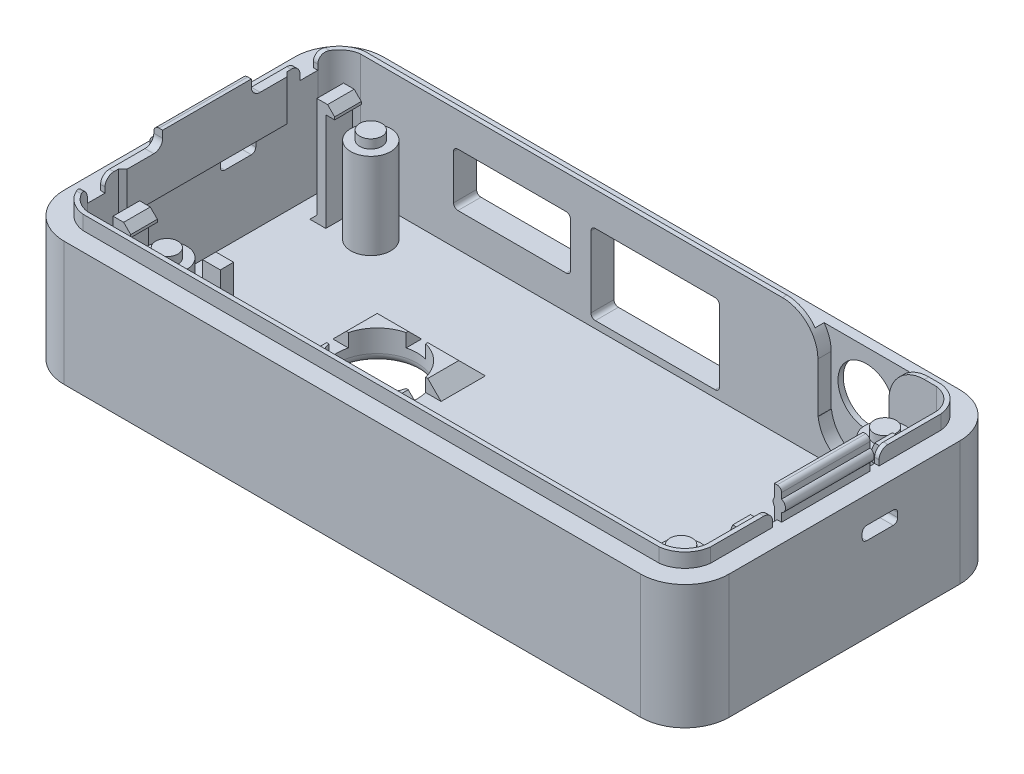
from build123d import *
from OCP.BRepFilletAPI import BRepFilletAPI_MakeChamfer

# Parameters (mm, degrees)
EXTRUDE_2_DEPTH       = 14
EXTRUDE_4_DEPTH       = 1.6
CUT_EXTRUDE_START     = -12
CUT_EXTRUDE_2_DEPTH   = 12
EXTRUDE_12_DEPTH      = 1.6
EXTRUDE_12_DEPTH_BACK = 2
SKETCH_5_W            = 0.3
SKETCH_5_H            = 10
SKETCH_15_R           = 2.25
EXTRUDE_13_DEPTH      = 9.7
SKETCH_16_R           = 1.25
EXTRUDE_14_DEPTH      = 1
SKETCH_17_W           = 0.5
SKETCH_17_H           = 1
CUT_EXTRUDE_3_DEPTH   = 1.6
SKETCH_19_W           = 0.8
SKETCH_19_H           = 10
EXTRUDE_15_DEPTH      = 1.8
SKETCH_20_R           = 0.7
EXTRUDE_16_DEPTH      = 10
FILLET_4_R            = 0.5
SKETCH_39_R           = 4
CUT_EXTRUDE_4_DEPTH   = 0.5
SKETCH_41_W           = 14.5
SKETCH_41_H           = 9
SKETCH_41_W_2         = 13.2
SKETCH_41_H_2         = 6
CUT_EXTRUDE_5_DEPTH   = 12
SKETCH_42_R           = 3.2
CUT_EXTRUDE_6_DEPTH   = 1.6
SKETCH_46_W           = 20
SKETCH_46_H           = 4.6
EXTRUDE_19_DEPTH      = 0.5
CHAMFER_3_SIZE        = 1
SKETCH_48_W           = 1
SKETCH_48_H           = 10
EXTRUDE_21_DEPTH      = 1.8
SKETCH_49_R           = 0.7
EXTRUDE_22_DEPTH      = 10
SKETCH_50_W           = 0.5
SKETCH_50_H           = 2
CUT_EXTRUDE_10_DEPTH  = 1.6
FILLET_9_R            = 1
FILLET_10_R           = 0.6
SKETCH_52_W           = 9.2
SKETCH_52_H           = 9.2
EXTRUDE_23_DEPTH      = 1.5
CHAMFER_5_SIZE        = 1.5
CUT_EXTRUDE_12_REACH  = 48.379
SKETCH_53_R           = 4.5
FILLET_14_R           = 1
SKETCH_55_W           = 12.2
SKETCH_55_H           = 2.2
CUT_EXTRUDE_13_DEPTH  = 1.5
SKETCH_56_W           = 2.2
SKETCH_56_H           = 12.2
CUT_EXTRUDE_14_DEPTH  = 1.5
FILLET_17_R           = 1
SKETCH_63_W           = 2
SKETCH_63_H           = 1.5
EXTRUDE_24_DEPTH      = 6
FILLET_18_R           = 0.5
CUT_EXTRUDE_15_DEPTH  = 0.5
CUT_EXTRUDE_16_REACH  = 81.068
SKETCH_67_W           = 4
SKETCH_67_H           = 1.5
FILLET_20_R           = 0.5
CUT_EXTRUDE_17_REACH  = 78.606
SKETCH_71_W           = 2
SKETCH_71_H           = 2
EXTRUDE_28_DEPTH      = 1.8
CHAMFER_6_SIZE        = 0.8
CHAMFER_6_SIZE2       = 1.980069483
SKETCH_73_W           = 1
SKETCH_73_H           = 3
EXTRUDE_30_DEPTH      = 12.2
SKETCH_74_W           = 3
SKETCH_74_H           = 1.1
EXTRUDE_31_DEPTH      = 1
CHAMFER_7_SIZE        = 0.8
SKETCH_75_R           = 4
CUT_EXTRUDE_19_DEPTH  = 1.5
SKETCH_76_W           = 8
SKETCH_76_H           = 9.611690882
CUT_EXTRUDE_20_DEPTH  = 1.5
FILLET_21_R           = 4
CUT_EXTRUDE_21_REACH  = 48.379
SKETCH_77_W           = 53.042222275
SKETCH_77_H           = 6.123277872
FILLET_22_R           = 1


# Read off the part's stored shape, not the designer's step: 切除-拉伸15
# Some blends are built 0.0001 mm under size
with BuildPart() as part:
    # case 2 → 凸台-拉伸2 (new body)
    with BuildSketch(Plane(origin=(0, 0, 0), x_dir=(1, 0, 0), z_dir=(0, 1, 0))):
        with BuildLine():
            Line((-34.042196447, 18), (30.957803553, 18))
            ThreePointArc((30.957803553, 18), (34.493337459, 16.535533906), (35.957803553, 13))
            Line((35.957803553, 13), (35.957803553, -13))
            ThreePointArc((35.957803553, -13), (34.493337459, -16.535533906), (30.957803553, -18))
            Line((30.957803553, -18), (-34.042196447, -18))
            ThreePointArc((-34.042196447, -18), (-37.577730353, -16.535533906), (-39.042196447, -13))
            Line((-39.042196447, -13), (-39.042196447, 13))
            ThreePointArc((-39.042196447, 13), (-37.577730353, 16.535533906), (-34.042196447, 18))
        make_face()
    extrude(amount=EXTRUDE_2_DEPTH)

    # 草图3 → 凸台-拉伸4 (add)
    with BuildSketch(Plane(origin=(0, 14, 0), x_dir=(1, 0, 0), z_dir=(0, 1, 0))):
        with BuildLine():
            Line((-36.942196447, 13), (-36.942196447, -13))
            ThreePointArc((-36.942196447, -13), (-35.997398295, -14.955201848), (-34.042196447, -15.9))
            Line((-34.042196447, -15.9), (30.957803553, -15.9))
            ThreePointArc((30.957803553, -15.9), (32.913005401, -14.955201848), (33.857803553, -13))
            Line((33.857803553, -13), (33.857803553, 13))
            ThreePointArc((33.857803553, 13), (32.913005401, 14.955201848), (30.957803553, 15.9))
            Line((30.957803553, 15.9), (-34.042196447, 15.9))
            ThreePointArc((-34.042196447, 15.9), (-35.997398295, 14.955201848), (-36.942196447, 13))
        make_face()
        with BuildLine():
            Line((-34.042196447, -15.4), (30.957803553, -15.4))
            ThreePointArc((30.957803553, -15.4), (32.562900965, -14.605097413), (33.357803553, -13))
            Line((33.357803553, -13), (33.357803553, 13))
            ThreePointArc((33.357803553, 13), (32.562900965, 14.605097413), (30.957803553, 15.4))
            Line((30.957803553, 15.4), (-34.042196447, 15.4))
            ThreePointArc((-34.042196447, 15.4), (-35.64729386, 14.605097413), (-36.442196447, 13))
            Line((-36.442196447, 13), (-36.442196447, -13))
            ThreePointArc((-36.442196447, -13), (-35.64729386, -14.605097413), (-34.042196447, -15.4))
        make_face(mode=Mode.SUBTRACT)
    extrude(amount=EXTRUDE_4_DEPTH)

    # 草图14 → 切除-拉伸2 (cut)
    with BuildSketch(Plane(origin=(0, 14, 0), x_dir=(1, 0, 0), z_dir=(0, 1, 0)).offset(CUT_EXTRUDE_START)):
        with BuildLine():
            Line((-34.042196447, -15.4), (30.957803553, -15.4))
            ThreePointArc((30.957803553, -15.4), (32.562900965, -14.605097413), (33.357803553, -13))
            Line((33.357803553, -13), (33.357803553, 13))
            ThreePointArc((33.357803553, 13), (32.562900965, 14.605097413), (30.957803553, 15.4))
            Line((30.957803553, 15.4), (-34.042196447, 15.4))
            ThreePointArc((-34.042196447, 15.4), (-35.64729386, 14.605097413), (-36.442196447, 13))
            Line((-36.442196447, 13), (-36.442196447, -13))
            ThreePointArc((-36.442196447, -13), (-35.64729386, -14.605097413), (-34.042196447, -15.4))
        make_face()
    extrude(amount=CUT_EXTRUDE_2_DEPTH, mode=Mode.SUBTRACT)

    # 草图5 → 凸台-拉伸12 (add, two sides: drawn at the far end of the back side and taken through both)
    with BuildSketch(Plane(origin=(0, 14, 0), x_dir=(1, 0, 0), z_dir=(0, 1, 0)).offset(-EXTRUDE_12_DEPTH_BACK)):
        with Locations((33.207803553, 0)):
            Rectangle(SKETCH_5_W, SKETCH_5_H)
    extrude(amount=EXTRUDE_12_DEPTH + EXTRUDE_12_DEPTH_BACK)

    # 草图15 → 凸台-拉伸13 (add)
    with BuildSketch(Plane(origin=(0, 2, 0), x_dir=(1, 0, 0), z_dir=(0, 1, 0))):
        with Locations(Location((29.060337171, -11.529492838, 0), (0, 0, 270))):
            Circle(SKETCH_15_R)
        with Locations(Location((-28.939662829, -11.529492838, 0), (0, 0, 270))):
            Circle(SKETCH_15_R)
        with Locations(Location((29.060337171, 11.470507162, 0), (0, 0, 270))):
            Circle(SKETCH_15_R)
        with Locations(Location((-28.939662829, 11.470507162, 0), (0, 0, 270))):
            Circle(SKETCH_15_R)
    extrude(amount=EXTRUDE_13_DEPTH)

    # 草图16 → 凸台-拉伸14 (add)
    with BuildSketch(Plane(origin=(0, 11.7, 0), x_dir=(1, 0, 0), z_dir=(0, 1, 0))):
        with Locations(Location((29.060337171, -11.529492838, 0), (0, 0, 270))):
            Circle(SKETCH_16_R)
        with Locations(Location((29.060337171, 11.470507162, 0), (0, 0, 270))):
            Circle(SKETCH_16_R)
        with Locations(Location((-28.939662829, -11.529492838, 0), (0, 0, 270))):
            Circle(SKETCH_16_R)
        with Locations(Location((-28.939662829, 11.470507162, 0), (0, 0, 270))):
            Circle(SKETCH_16_R)
    extrude(amount=EXTRUDE_14_DEPTH)

    # 草图17 → 切除-拉伸3 (cut)
    with BuildSketch(Plane(origin=(0, 15.6, 0), x_dir=(1, 0, 0), z_dir=(0, 1, 0))):
        with Locations((33.607803553, -5.5)):
            Rectangle(SKETCH_17_W, SKETCH_17_H)
        with Locations((33.607803553, 5.5)):
            Rectangle(SKETCH_17_W, SKETCH_17_H)
    extrude(amount=-CUT_EXTRUDE_3_DEPTH, mode=Mode.SUBTRACT)

    # 草图19 → 凸台-拉伸15 (add)
    with BuildSketch(Plane(origin=(0, 15.6, 0), x_dir=(1, 0, 0), z_dir=(0, 1, 0))):
        with Locations((33.457803553, 0)):
            Rectangle(SKETCH_19_W, SKETCH_19_H)
    extrude(amount=EXTRUDE_15_DEPTH)

    # 草图20 → 凸台-拉伸16 (add)
    with BuildSketch(Plane(origin=(0, 0, -5), x_dir=(-1, 0, 0), z_dir=(0, 0, -1))):
        with Locations((-33.607803553, 15.6)):
            Circle(SKETCH_20_R)
    extrude(amount=-EXTRUDE_16_DEPTH)

    # 圆角4
    fillet_4_edges = [part.edges().sort_by_distance(p)[0] for p in [
        (33.857803553, 17.4, 0),
    ]]
    fillet(fillet_4_edges, radius=FILLET_4_R)

    # 草图39 → 切除-拉伸4 (cut)
    with BuildSketch(Plane(origin=(0, 0, -18), x_dir=(-1, 0, 0), z_dir=(0, 0, -1))):
        with Locations((-21.521910192, 9.17282056)):
            Circle(SKETCH_39_R)
    extrude(amount=-CUT_EXTRUDE_4_DEPTH, mode=Mode.SUBTRACT)

    # 草图41 → 切除-拉伸5 (cut)
    with BuildSketch(Plane(origin=(0, 0, -18), x_dir=(-1, 0, 0), z_dir=(0, 0, -1))):
        with Locations((0.792196447, 7.3)):
            Rectangle(SKETCH_41_W, SKETCH_41_H)
        with Locations((16.942196447, 8.8)):
            Rectangle(SKETCH_41_W_2, SKETCH_41_H_2)
    extrude(amount=-CUT_EXTRUDE_5_DEPTH, mode=Mode.SUBTRACT)

    # 草图42 → 切除-拉伸6 (cut)
    with BuildSketch(Plane(origin=(0, 0, -17.5), x_dir=(-1, 0, 0), z_dir=(0, 0, -1))):
        with Locations((-21.521910192, 9.17282056)):
            Circle(SKETCH_42_R)
    extrude(amount=-CUT_EXTRUDE_6_DEPTH, mode=Mode.SUBTRACT)

    # 草图46 → 凸台-拉伸19 (add)
    with BuildSketch(Plane(origin=(-36.442196447, 0, 0), x_dir=(0, 0, -1), z_dir=(1, 0, 0))):
        with Locations((0, 13.3)):
            Rectangle(SKETCH_46_W, SKETCH_46_H)
    extrude(amount=EXTRUDE_19_DEPTH)

    # 倒角3
    # the kernel refuses this chamfer: 1 mm, written as the material it takes off along each edge
    with BuildSketch(Plane(origin=(-35.942196447, 18.171682988, -10), x_dir=(-0.9996219169112968, 0, -0.02749587661058555), z_dir=(0, -1, 0))) as chamfer_3_piece_1_section:
        Polygon((CHAMFER_3_SIZE * 0.999621916911, -CHAMFER_3_SIZE * 0.0274958766106), (-CHAMFER_3_SIZE * 0.0274958766106, -CHAMFER_3_SIZE * 0.999621916911), (0, 0), align=None)
    chamfer_3_piece_1 = extrude(amount=9.743365976, mode=Mode.PRIVATE)
    chamfer_3_piece_1 = split(chamfer_3_piece_1, bisect_by=Plane(origin=(-36.442196447, 13.3, -9.606598916), z_dir=(1, 0, 0)), keep=Keep.TOP, mode=Mode.PRIVATE)
    add(chamfer_3_piece_1, mode=Mode.SUBTRACT)
    with BuildSketch(Plane(origin=(-35.942196447, 8.428317012, 10), x_dir=(-0.9996219169112968, 0, 0.02749587661058555), z_dir=(0, 1, 0))) as chamfer_3_piece_2_section:
        Polygon((CHAMFER_3_SIZE * 0.999621916911, -CHAMFER_3_SIZE * 0.0274958766106), (-CHAMFER_3_SIZE * 0.0274958766106, -CHAMFER_3_SIZE * 0.999621916911), (0, 0), align=None)
    chamfer_3_piece_2 = extrude(amount=9.743365976, mode=Mode.PRIVATE)
    chamfer_3_piece_2 = split(chamfer_3_piece_2, bisect_by=Plane(origin=(-36.442196447, 13.3, 9.606598916), z_dir=(1, 0, 0)), keep=Keep.TOP, mode=Mode.PRIVATE)
    add(chamfer_3_piece_2, mode=Mode.SUBTRACT)

    # 草图48 → 凸台-拉伸21 (add)
    with BuildSketch(Plane(origin=(0, 15.6, 0), x_dir=(1, 0, 0), z_dir=(0, 1, 0))):
        with Locations((-36.442196447, 0)):
            Rectangle(SKETCH_48_W, SKETCH_48_H)
    extrude(amount=EXTRUDE_21_DEPTH)

    # 草图49 → 凸台-拉伸22 (add)
    with BuildSketch(Plane.XY.offset(5)):
        with Locations((-36.692196447, 15.6)):
            Circle(SKETCH_49_R)
    extrude(amount=-EXTRUDE_22_DEPTH)

    # 草图50 → 切除-拉伸10 (cut)
    with BuildSketch(Plane(origin=(0, 15.6, 0), x_dir=(1, 0, 0), z_dir=(0, 1, 0))):
        with Locations((-36.692196447, 12)):
            Rectangle(SKETCH_50_W, SKETCH_50_H)
        with Locations((-36.692196447, -12)):
            Rectangle(SKETCH_50_W, SKETCH_50_H)
    extrude(amount=-CUT_EXTRUDE_10_DEPTH, mode=Mode.SUBTRACT)

    # 圆角9
    fillet_9_edges = [part.edges().sort_by_distance(p)[0] for p in [
        (33.607803553, 15.6, 6),
        (33.607803553, 15.6, -6),
        (-36.692196447, 15.6, -13),
        (-36.692196447, 15.6, -11),
        (-36.692196447, 15.6, 11),
        (-36.692196447, 15.6, 13),
    ]]
    fillet(fillet_9_edges, radius=FILLET_9_R)

    # 圆角10
    fillet_10_edges = [part.edges().sort_by_distance(p)[0] for p in [
        (-36.942196447, 17.4, 0),
    ]]
    fillet(fillet_10_edges, radius=FILLET_10_R)

    # 草图52 → 凸台-拉伸23 (add)
    with BuildSketch(Plane(origin=(0, 2, 0), x_dir=(1, 0, 0), z_dir=(0, 1, 0))):
        with Locations((-15.242196447, -1.5)):
            Rectangle(SKETCH_52_W, SKETCH_52_H)
    extrude(amount=EXTRUDE_23_DEPTH)

    # 倒角5
    chamfer_5_edges = [part.edges().sort_by_distance(p)[0] for p in [
        (-15.242196447, 2, -3.1),
        (-10.642196447, 2, 1.5),
        (-15.242196447, 2, 6.1),
        (-19.842196447, 2, 1.5),
    ]]
    chamfer(chamfer_5_edges, length=CHAMFER_5_SIZE - 0.0001)  # a hair under: the kernel refuses the full size

    # 草图53 → 切除-拉伸12 (cut, up to next)
    with BuildSketch(Plane.XZ, mode=Mode.PRIVATE) as cut_extrude_12_sk1:
        with Locations(Location((-15.242196447, 1.5, 0), (0, 0, 270))):
            Circle(SKETCH_53_R)
    cut_extrude_12_tool1 = extrude(cut_extrude_12_sk1.sketch, amount=-CUT_EXTRUDE_12_REACH, mode=Mode.PRIVATE) & part.part
    add(cut_extrude_12_tool1.solids().sort_by_distance((-15.242196, 0, 1.5))[0], mode=Mode.SUBTRACT)

    # 圆角14
    fillet_14_edges = [part.edges().sort_by_distance(p)[0] for p in [
        (-15.242196447, 0, 6),
    ]]
    fillet(fillet_14_edges, radius=FILLET_14_R)

    # 草图55 → 切除-拉伸13 (cut)
    with BuildSketch(Plane(origin=(0, 3.5, 0), x_dir=(1, 0, 0), z_dir=(0, 1, 0))):
        with Locations((-15.242196447, -1.5)):
            Rectangle(SKETCH_55_W, SKETCH_55_H)
    extrude(amount=-CUT_EXTRUDE_13_DEPTH, mode=Mode.SUBTRACT)

    # 草图56 → 切除-拉伸14 (cut)
    with BuildSketch(Plane(origin=(0, 3.5, 0), x_dir=(1, 0, 0), z_dir=(0, 1, 0))):
        with Locations((-15.242196447, -1.5)):
            Rectangle(SKETCH_56_W, SKETCH_56_H)
    extrude(amount=-CUT_EXTRUDE_14_DEPTH, mode=Mode.SUBTRACT)

    # 圆角17
    # the kernel refuses this fillet: 1 mm, written as the material it adds along each edge
    with BuildSketch(Plane(origin=(-36.942196447, 15.6, -5), x_dir=(0, 0, -1), z_dir=(1, 0, 0)), Plane(origin=(-35.942196447, 15.6, 5), x_dir=(0, 0, 1), z_dir=(-1, 0, 0))) as fillet_17_piece_1:
        with BuildLine():
            CenterArc((FILLET_17_R, FILLET_17_R), FILLET_17_R, 180, 90)
            Line((0, FILLET_17_R), (0, 0))
            Line((0, 0), (FILLET_17_R, 0))
        make_face()
    extrude(amount=1)

    # 草图63 → 凸台-拉伸24 (add)
    with BuildSketch(Plane(origin=(0, 2, 0), x_dir=(1, 0, 0), z_dir=(0, 1, 0))):
        with Locations((-29.442196447, -5.25)):
            Rectangle(SKETCH_63_W, SKETCH_63_H)
    extrude(amount=EXTRUDE_24_DEPTH)

    # 圆角18
    fillet_18_edges = [part.edges().sort_by_distance(p)[0] for p in [
        (6.457803553, 2.8, -16.7),
        (6.457803553, 11.8, -16.7),
        (-8.042196447, 11.8, -16.7),
        (-8.042196447, 2.8, -16.7),
        (-10.342196447, 5.8, -16.7),
        (-10.342196447, 11.8, -16.7),
        (-23.542196447, 11.8, -16.7),
        (-23.542196447, 5.8, -16.7),
    ]]
    fillet(fillet_18_edges, radius=FILLET_18_R)

    # 切除-拉伸15 outline → 切除-拉伸15 (cut)
    with BuildSketch(Plane(origin=(0, 0, 0), x_dir=(1, 0, 0), z_dir=(0, 1, 0))):
        with BuildLine():
            add(Edge.make_bspline(
                [(26.920722884, 6.833155185), (27.053776021, 6.757558732), (27.20148009, 6.715969894), (27.49780189, 6.712576515), (27.646384842, 6.750772373), (27.78116905, 6.823301641)],
                knots=[4, 4, 4, 4, 5, 5, 6, 6, 6, 6], degree=3))
            Line((27.78116905, 6.823301641), (28.194169459, 7.057938986))
            Line((28.194169459, 7.057938986), (30.336531894, 8.261545504))
            Line((30.336531894, 8.261545504), (30.749499644, 8.493330924))
            add(Edge.make_bspline(
                [(31.188238435, 9.232025797), (31.184747278, 8.927165616), (31.019098798, 8.644111097), (30.749499644, 8.493330924)],
                knots=[21, 21, 21, 21, 22, 22, 22, 22], degree=3))
            Line((31.188238435, 9.232025797), (31.227260896, 12.639604768))
            add(Edge.make_bspline(
                [(30.805553521, 13.388153184), (31.071629058, 13.231238642), (31.230784514, 12.947299482), (31.227260896, 12.639604768)],
                knots=[19, 19, 19, 19, 20, 20, 20, 20], degree=3))
            Line((30.805553521, 13.388153184), (30.398002034, 13.629334918))
            Line((30.398002034, 13.629334918), (28.283764415, 14.881686604))
            Line((28.283764415, 14.881686604), (27.876245388, 15.125702872))
            add(Edge.make_bspline(
                [(27.876245388, 15.125702872), (27.743190329, 15.204169037), (27.595488381, 15.242905553), (27.299166581, 15.246298931), (27.150581509, 15.210955396), (27.015799222, 15.135556415)],
                knots=[15, 15, 15, 15, 16, 16, 17, 17, 17, 17], degree=3))
            Line((27.015799222, 15.135556415), (26.602764232, 14.900936859))
            Line((26.602764232, 14.900936859), (24.460401797, 13.697330341))
            Line((24.460401797, 13.697330341), (24.047399267, 13.465545319))
            add(Edge.make_bspline(
                [(23.608660477, 12.726850447), (23.612184094, 13.034545161), (23.780686816, 13.314732088), (24.047399267, 13.465545319)],
                knots=[10, 10, 10, 10, 11, 11, 11, 11], degree=3))
            Line((23.608660477, 12.726850447), (23.569638016, 9.319271475))
            add(Edge.make_bspline(
                [(23.991345391, 8.57072306), (23.728156557, 8.727604543), (23.566146858, 9.014411295), (23.569638016, 9.319271475)],
                knots=[8, 8, 8, 8, 9, 9, 9, 9], degree=3))
            Line((23.991345391, 8.57072306), (24.398931658, 8.329540927))
            Line((24.398931658, 8.329540927), (26.513169276, 7.077189241))
            Line((26.513169276, 7.077189241), (26.920722884, 6.833155185))
        make_face()
        with BuildLine():
            add(Edge.make_bspline(
                [(24.521047756, 9.288427557), (24.526784262, 9.291214162), (27.119415548, 10.748962537)],
                knots=[0, 0, 0, 1, 1, 1], degree=2))
            add(Edge.make_bspline(
                [(27.119415548, 10.748962537), (27.291499135, 10.846735342), (27.505184715, 10.844288286), (27.675018923, 10.742599951)],
                knots=[7, 7, 7, 7, 8, 8, 8, 8], degree=3))
            Line((27.675018923, 10.742599951), (30.201859487, 9.192032303))
            add(Edge.make_bspline(
                [(30.201859487, 9.192032303), (30.334847107, 9.110714613), (30.329776543, 8.917007767), (30.194994455, 8.841626176)],
                knots=[5, 5, 5, 5, 6, 6, 6, 6], degree=3))
            Line((30.194994455, 8.841626176), (27.559194726, 7.347309678))
            add(Edge.make_bspline(
                [(27.559194726, 7.347309678), (27.433033528, 7.277516566), (27.279168781, 7.279278574), (27.157456098, 7.351910255)],
                knots=[3, 3, 3, 3, 4, 4, 4, 4], degree=3))
            Line((27.157456098, 7.351910255), (24.542275666, 8.903506934))
            add(Edge.make_bspline(
                [(24.542275666, 8.903506934), (24.397912813, 8.987789795), (24.386037252, 9.193099892), (24.521047756, 9.288427557)],
                knots=[1, 1, 1, 1, 2, 2, 2, 2], degree=3))
        make_face(mode=Mode.SUBTRACT)
        with BuildLine():
            add(Edge.make_bspline(
                [(28.427651717, 12.019114964), (28.744666121, 11.833128897), (28.921278817, 11.82825409), (28.927575884, 12.378136229), (28.776486508, 12.619215949), (28.453733677, 12.805285122)],
                knots=[6, 6, 6, 6, 7, 7, 7.969419532, 7.969419532, 7.969419532, 7.969419532], degree=3))
            Line((28.453733677, 12.805285122), (28.19313589, 12.939353339))
            Line((28.19313589, 12.939353339), (28.19933498, 13.480679707))
            Line((28.19933498, 13.480679707), (28.493764533, 13.312048667))
            add(Edge.make_bspline(
                [(28.493764533, 13.312048667), (29.074032692, 12.974850184), (29.57738203, 12.390643555), (29.562014445, 11.048691854), (29.058528718, 11.122843175), (28.452756346, 11.474577819)],
                knots=[10, 10, 10, 10, 11, 11, 12.038972706, 12.038972706, 12.038972706, 12.038972706], degree=3))
            Line((28.452756346, 11.474577819), (27.518627194, 12.018133013))
            add(Edge.make_bspline(
                [(27.518627194, 12.018133013), (27.498796289, 12.02689961), (27.490468934, 12.046943662), (27.49069735, 12.066889736)],
                knots=[7, 7, 7, 7, 8, 8, 8, 8], degree=3))
            Line((27.49069735, 12.066889736), (27.520910369, 14.705197143))
            add(Edge.make_bspline(
                [(27.520910369, 14.705197143), (27.52139986, 14.747941215), (27.567289391, 14.773051596), (27.6041012, 14.752681349)],
                knots=[5, 5, 5, 5, 6, 6, 6, 6], degree=3))
            Line((27.6041012, 14.752681349), (28.153263715, 14.432952862))
            add(Edge.make_bspline(
                [(28.153263715, 14.432952862), (28.173061962, 14.421334342), (28.181387196, 14.404142611), (28.18115878, 14.384196537)],
                knots=[3, 3, 3, 3, 4, 4, 4, 4], degree=3))
            Line((28.18115878, 14.384196537), (28.156231386, 12.207448592))
            add(Edge.make_bspline(
                [(28.156231386, 12.207448592), (28.156002971, 12.187502517), (28.167182248, 12.167425806), (28.18419601, 12.15869147)],
                knots=[4, 4, 4, 4, 5, 5, 5, 5], degree=3))
            Line((28.18419601, 12.15869147), (28.427651717, 12.019114964))
        make_face(mode=Mode.SUBTRACT)
        with BuildLine():
            add(Edge.make_bspline(
                [(30.126962568, 11.609272898), (30.344949039, 11.484249545), (30.498988117, 11.251675545), (30.496736817, 11.055084116), (30.494452859, 10.855640764), (30.337151039, 10.803300657), (30.119197227, 10.931175934)],
                knots=[2, 2, 2, 2, 3, 3, 3, 4, 4, 4, 4], degree=3))
            add(Edge.make_bspline(
                [(30.119197227, 10.931175934), (29.89842627, 11.059083472), (29.744319754, 11.288805947), (29.746636372, 11.491101222), (29.748887672, 11.687692651), (29.906224271, 11.74003236), (30.126962568, 11.609272898)],
                knots=[0, 0, 0, 0, 1, 1, 1, 2, 2, 2, 2], degree=3))
        make_face(mode=Mode.SUBTRACT)
        with BuildLine():
            Line((29.899904994, 13.429864857), (30.443361542, 13.11305401))
            add(Edge.make_bspline(
                [(30.443361542, 13.11305401), (30.460375105, 13.104302284), (30.471554383, 13.084225573), (30.471325967, 13.064279499)],
                knots=[0, 0, 0, 0, 1, 1, 1, 1], degree=3))
            Line((30.471325967, 13.064279499), (30.456970023, 11.810667865))
            add(Edge.make_bspline(
                [(30.456970023, 11.810667865), (30.456480532, 11.767923793), (30.410591002, 11.742813412), (30.373778993, 11.763166269)],
                knots=[6, 6, 6, 6, 7, 7, 7, 7], degree=3))
            Line((30.373778993, 11.763166269), (29.830289985, 12.077142582))
            add(Edge.make_bspline(
                [(29.830289985, 12.077142582), (29.813308882, 12.088728841), (29.802097144, 12.105971019), (29.802325361, 12.125899704)],
                knots=[4, 4, 4, 4, 5, 5, 5, 5], degree=3))
            Line((29.802325361, 12.125899704), (29.816714163, 13.382380651))
            add(Edge.make_bspline(
                [(29.816714163, 13.382380651), (29.817203455, 13.425107333), (29.863093184, 13.450235104), (29.899904994, 13.429864857)],
                knots=[2, 2, 2, 2, 3, 3, 3, 3], degree=3))
        make_face(mode=Mode.SUBTRACT)
    extrude(amount=CUT_EXTRUDE_15_DEPTH, mode=Mode.SUBTRACT)

    # 草图67 → 切除-拉伸16 (cut, up to next)
    with BuildSketch(Plane.ZY.offset(39.042196447), mode=Mode.PRIVATE) as cut_extrude_16_sk1:
        with Locations((-4, 10.25)):
            Rectangle(SKETCH_67_W, SKETCH_67_H)
    cut_extrude_16_tool1 = extrude(cut_extrude_16_sk1.sketch, amount=-CUT_EXTRUDE_16_REACH, mode=Mode.PRIVATE) & part.part
    add(cut_extrude_16_tool1.solids().sort_by_distance((-39.042196, 10.25, -4))[0], mode=Mode.SUBTRACT)

    # 圆角20
    fillet_20_edges = [part.edges().sort_by_distance(p)[0] for p in [
        (-37.742196447, 9.5, -6),
        (-37.742196447, 11, -2),
        (-37.742196447, 9.5, -2),
        (-37.742196447, 11, -6),
    ]]
    fillet(fillet_20_edges, radius=FILLET_20_R)

    # 草图68 → 切除-拉伸17 (cut, up to next)
    with BuildSketch(Plane.ZY.offset(-33.357803553), mode=Mode.PRIVATE) as cut_extrude_17_sk1:
        with BuildLine():
            Line((-2, 10), (-2, 10.5))
            ThreePointArc((-2, 10.5), (-2.146446609, 10.853553391), (-2.5, 11))
            Line((-2.5, 11), (-5.5, 11))
            ThreePointArc((-5.5, 11), (-5.853553391, 10.853553391), (-6, 10.5))
            Line((-6, 10.5), (-6, 10))
            ThreePointArc((-6, 10), (-5.853553391, 9.646446609), (-5.5, 9.5))
            Line((-5.5, 9.5), (-2.5, 9.5))
            ThreePointArc((-2.5, 9.5), (-2.146446609, 9.646446609), (-2, 10))
        make_face()
    cut_extrude_17_tool1 = extrude(cut_extrude_17_sk1.sketch, amount=-CUT_EXTRUDE_17_REACH, mode=Mode.PRIVATE) & part.part
    add(cut_extrude_17_tool1.solids().sort_by_distance((33.357804, 10.25, -4))[0], mode=Mode.SUBTRACT)

    # 草图71 → 凸台-拉伸28 (add)
    with BuildSketch(Plane.ZY.offset(-33.357803553)):
        with Locations((-8, 14)):
            Rectangle(SKETCH_71_W, SKETCH_71_H)
        with Locations((8, 14)):
            Rectangle(SKETCH_71_W, SKETCH_71_H)
    extrude(amount=EXTRUDE_28_DEPTH)

    # 倒角6: one chamfer whose edges measure the first distance from different faces: ONE call of the kernel's chamfer builder (chamfer() names one face for all edges)
    chamfer_6_edges_1 = [part.edges().sort_by_distance(p)[0] for p in [
        (31.557803553, 15, -8),
    ]]
    chamfer_6_side_1 = [part.faces().sort_by_distance(p)[0] for p in [
        (32.457803553, 15, -8),
    ]]
    chamfer_6_edges_2 = [part.edges().sort_by_distance(p)[0] for p in [
        (31.557803553, 15, 8),
    ]]
    chamfer_6_side_2 = [part.faces().sort_by_distance(p)[0] for p in [
        (32.457803553, 15, 8),
    ]]
    chamfer_6 = BRepFilletAPI_MakeChamfer(part.part.solid().wrapped)
    for e in chamfer_6_edges_1:
        chamfer_6.Add(CHAMFER_6_SIZE, CHAMFER_6_SIZE2, e.wrapped, chamfer_6_side_1[0].wrapped)  # the first distance lies on this face
    for e in chamfer_6_edges_2:
        chamfer_6.Add(CHAMFER_6_SIZE, CHAMFER_6_SIZE2, e.wrapped, chamfer_6_side_2[0].wrapped)  # the first distance lies on this face
    add(Compound.cast(chamfer_6.Shape()), mode=Mode.REPLACE)

    # 草图73 → 凸台-拉伸30 (add)
    with BuildSketch(Plane(origin=(0, 2, 0), x_dir=(1, 0, 0), z_dir=(0, 1, 0))):
        with Locations((-33.042196447, 11.5)):
            Rectangle(SKETCH_73_W, SKETCH_73_H)
        with Locations((-33.042196447, -11.5)):
            Rectangle(SKETCH_73_W, SKETCH_73_H)
    extrude(amount=EXTRUDE_30_DEPTH)

    # 草图74 → 凸台-拉伸31 (add)
    with BuildSketch(Plane(origin=(-32.542196447, 0, 0), x_dir=(0, 0, -1), z_dir=(1, 0, 0))):
        with Locations((11.5, 13.65)):
            Rectangle(SKETCH_74_W, SKETCH_74_H)
        with Locations((-11.5, 13.65)):
            Rectangle(SKETCH_74_W, SKETCH_74_H)
    extrude(amount=EXTRUDE_31_DEPTH)

    # 倒角7
    chamfer_7_edges = [part.edges().sort_by_distance(p)[0] for p in [
        (-33.542196447, 2, -11.5),
        (-33.542196447, 2, 11.5),
        (-31.542196447, 14.2, -11.5),
        (-31.542196447, 14.2, 11.5),
    ]]
    chamfer(chamfer_7_edges, length=CHAMFER_7_SIZE)

    # 草图75 → 切除-拉伸19 (cut)
    with BuildSketch(Plane.XY.offset(-15.4)):
        with Locations((21.559484829, 6.45)):
            Circle(SKETCH_75_R)
    extrude(amount=-CUT_EXTRUDE_19_DEPTH, mode=Mode.SUBTRACT)

    # 草图76 → 切除-拉伸20 (cut)
    with BuildSketch(Plane.XY.offset(-15.4)):
        with Locations((21.559484829, 10.794154559)):
            Rectangle(SKETCH_76_W, SKETCH_76_H)
    extrude(amount=-CUT_EXTRUDE_20_DEPTH, mode=Mode.SUBTRACT)

    # 圆角21
    # the kernel refuses this fillet: 4 mm, written as the material it takes off along each edge
    with BuildSketch(Plane(origin=(25.559484829, 15.6, -5.4), x_dir=(1, 0, 0), z_dir=(0, 0, -1))) as fillet_21_piece_1_section:
        with BuildLine():
            CenterArc((FILLET_21_R, FILLET_21_R), FILLET_21_R, 180, 90)
            Line((0, FILLET_21_R), (0, 0))
            Line((0, 0), (FILLET_21_R, 0))
        make_face()
    fillet_21_piece_1 = extrude(amount=20.5, mode=Mode.PRIVATE)
    fillet_21_piece_1 = split(fillet_21_piece_1, bisect_by=Plane(origin=(26.595721969, 14.987157554, -16.9), z_dir=(0, 0, 1)), keep=Keep.TOP, mode=Mode.PRIVATE)
    add(fillet_21_piece_1, mode=Mode.SUBTRACT)
    with BuildSketch(Plane(origin=(17.559484829, 15.6, -5.4), x_dir=(0, -1, 0), z_dir=(0, 0, -1))) as fillet_21_piece_2_section:
        with BuildLine():
            CenterArc((FILLET_21_R, FILLET_21_R), FILLET_21_R, 180, 90)
            Line((0, FILLET_21_R), (0, 0))
            Line((0, 0), (FILLET_21_R, 0))
        make_face()
    fillet_21_piece_2 = extrude(amount=20.5, mode=Mode.PRIVATE)
    fillet_21_piece_2 = split(fillet_21_piece_2, bisect_by=Plane(origin=(17.324245278, 13.412662438, -16.9), z_dir=(0, 0, 1)), keep=Keep.TOP, mode=Mode.PRIVATE)
    add(fillet_21_piece_2, mode=Mode.SUBTRACT)

    # 草图77 → 切除-拉伸21 (cut, up to next)
    with BuildSketch(Plane.XZ, mode=Mode.PRIVATE) as cut_extrude_21_sk1:
        with Locations((0.095263365, 11.538361064)):
            Rectangle(SKETCH_77_W, SKETCH_77_H)
    cut_extrude_21_tool1 = extrude(cut_extrude_21_sk1.sketch, amount=-CUT_EXTRUDE_21_REACH, mode=Mode.PRIVATE) & part.part
    add(cut_extrude_21_tool1.solids().sort_by_distance((0.095263, 0, 11.538361))[0], mode=Mode.SUBTRACT)

    # 圆角22
    fillet_22_edges = [part.edges().sort_by_distance(p)[0] for p in [
        (-26.425847773, 1, 8.476722128),
        (-26.425847773, 1, 14.6),
        (26.616374502, 1, 14.6),
        (26.616374502, 1, 8.476722128),
    ]]
    fillet(fillet_22_edges, radius=FILLET_22_R)


solid = part.part
